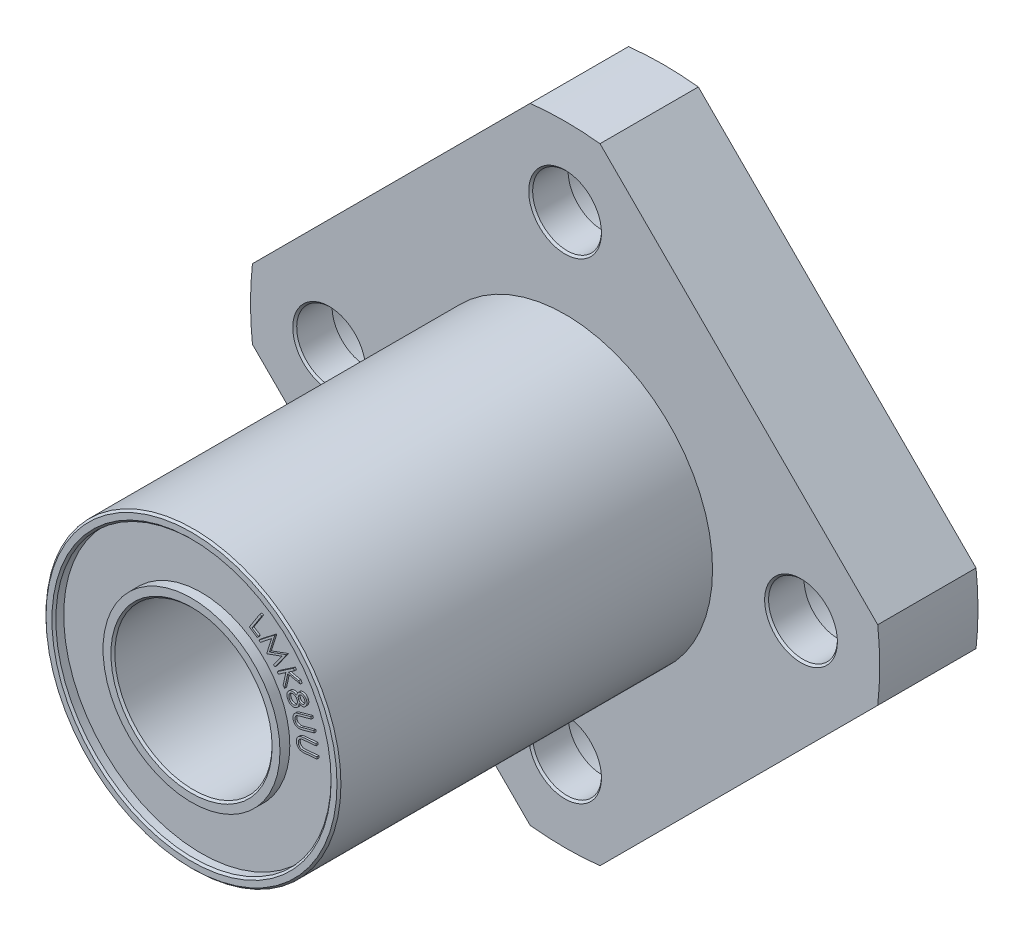
from build123d import *

# Parameters (mm, degrees)
BOSS_EXTRUDE1_DEPTH = 5
SKETCH2_R           = 7.5
BOSS_EXTRUDE2_DEPTH = 19
SKETCH3_R           = 3
CUT_EXTRUDE1_DEPTH  = 3.1
SKETCH4_R           = 1.75
CUT_EXTRUDE2_DEPTH  = 1.9
CHAMFER1_SIZE       = 0.1
SKETCH5_R           = 4
CUT_EXTRUDE3_DEPTH  = 33.984845005
SKETCH6_R           = 7
SKETCH6_R_2         = 4.5
CUT_EXTRUDE4_DEPTH  = 0.5
CUT_EXTRUDE5_START  = -0.5
SKETCH7_R           = 7
SKETCH7_R_2         = 4.5
CUT_EXTRUDE5_DEPTH  = 0.5
BOSS_EXTRUDE3_DEPTH = 0.1
CHAMFER2_SIZE       = 0.1
BOSS_EXTRUDE4_DEPTH = 0.1


# Read off the part's stored shape, not the designer's step: CirPattern1
with BuildPart() as part:
    # Sketch1 → Boss-Extrude1 (new body)
    with BuildSketch(Plane.XY):
        with BuildLine():
            Line((-1.776611319, 15.901058211), (-15.901058211, 1.776611319))
            ThreePointArc((-15.901058211, 1.776611319), (-16, 0), (-15.901058211, -1.776611319))
            Line((-15.901058211, -1.776611319), (-1.776611319, -15.901058211))
            ThreePointArc((-1.776611319, -15.901058211), (0, -16), (1.776611319, -15.901058211))
            Line((1.776611319, -15.901058211), (15.901058211, -1.776611319))
            ThreePointArc((15.901058211, -1.776611319), (16, 0), (15.901058211, 1.776611319))
            Line((15.901058211, 1.776611319), (1.776611319, 15.901058211))
            ThreePointArc((1.776611319, 15.901058211), (0, 16), (-1.776611319, 15.901058211))
        make_face()
    extrude(amount=BOSS_EXTRUDE1_DEPTH)

    # Sketch2 → Boss-Extrude2 (add)
    with BuildSketch(Plane.XY.offset(5)):
        Circle(SKETCH2_R)
    extrude(amount=BOSS_EXTRUDE2_DEPTH)

    # Sketch3 → Cut-Extrude1 (cut)
    with BuildSketch(Plane(origin=(0, 0, 0), x_dir=(-1, 0, 0), z_dir=(0, 0, -1))):
        with Locations((0, 12)):
            Circle(SKETCH3_R)
    extrude(amount=-CUT_EXTRUDE1_DEPTH, mode=Mode.SUBTRACT)

    # Sketch4 → Cut-Extrude2 (cut)
    with BuildSketch(Plane(origin=(0, 0, 3.1), x_dir=(-1, 0, 0), z_dir=(0, 0, -1))):
        with Locations((0, 12)):
            Circle(SKETCH4_R)
    extrude(amount=-CUT_EXTRUDE2_DEPTH, mode=Mode.SUBTRACT)

    # Chamfer1
    chamfer1_edges = [part.edges().sort_by_distance(p)[0] for p in [
        (-7.5, 0, 24),
        (3, 12, 0),
        (1.75, 12, 5),
    ]]
    chamfer(chamfer1_edges, length=CHAMFER1_SIZE)

    # CirPattern1 outline → CirPattern1 (revolve, cut)
    with BuildSketch(Plane(origin=(-12, 0, 0), x_dir=(1, 0, 0), z_dir=(0, -1, 0))):
        Polygon((0, 0), (3.1, 0), (3, 0.1), (3, 3.1), (1.75, 3.1), (1.75, 4.9), (1.85, 5), (0, 5), align=None)
    revolve(axis=Axis((-12, 0, 0), (0, 0, 1)), mode=Mode.SUBTRACT)

    # CirPattern1 2 outline → CirPattern1 2 (revolve, cut)
    with BuildSketch(Plane.XZ.offset(12)):
        Polygon((0, 0), (3.1, 0), (3, 0.1), (3, 3.1), (1.75, 3.1), (1.75, 4.9), (1.85, 5), (0, 5), align=None)
    revolve(axis=Axis((0, -12, 0), (0, 0, 1)), mode=Mode.SUBTRACT)

    # CirPattern1 3 outline → CirPattern1 3 (revolve, cut)
    with BuildSketch(Plane(origin=(12, 0, 0), x_dir=(1, 0, 0), z_dir=(0, -1, 0))):
        Polygon((0, 0), (3.1, 0), (3, 0.1), (3, 3.1), (1.75, 3.1), (1.75, 4.9), (1.85, 5), (0, 5), align=None)
    revolve(axis=Axis((12, 0, 0), (0, 0, 1)), mode=Mode.SUBTRACT)

    # Sketch5 → Cut-Extrude3 (cut, through all)
    with BuildSketch(Plane.XY.offset(24)):
        Circle(SKETCH5_R)
    extrude(amount=-CUT_EXTRUDE3_DEPTH, mode=Mode.SUBTRACT)

    # Sketch6 → Cut-Extrude4 (cut)
    with BuildSketch(Plane.XY.offset(24)):
        Circle(SKETCH6_R)
        Circle(SKETCH6_R_2, mode=Mode.SUBTRACT)
    extrude(amount=-CUT_EXTRUDE4_DEPTH, mode=Mode.SUBTRACT)

    # Sketch7 → Cut-Extrude5 (cut)
    with BuildSketch(Plane(origin=(0, 0, 0), x_dir=(-1, 0, 0), z_dir=(0, 0, -1)).offset(CUT_EXTRUDE5_START)):
        with Locations(Location((0, 0, 0), (0, 0, 180))):
            Circle(SKETCH7_R)
        with Locations(Location((0, 0, 0), (0, 0, 180))):
            Circle(SKETCH7_R_2, mode=Mode.SUBTRACT)
    extrude(amount=CUT_EXTRUDE5_DEPTH, mode=Mode.SUBTRACT)

    # Sketch8 → Boss-Extrude3 (add)
    # profile 1 of 6: a face of its own
    with BuildSketch(Plane.XY.offset(23.5)):
        with BuildLine():
            Line((5.925489592, 0.855844326), (5.934504015, 0.756485352))
            Line((5.934504015, 0.756485352), (5.334143438, 0.702999775))
            add(Edge.make_bspline(
                [(5.334143438, 0.702999775), (5.32566379, 0.702193023), (5.309504878, 0.700655668), (5.286517337, 0.69855424), (5.266100387, 0.696265421), (5.248184857, 0.69435885), (5.232842747, 0.692290465), (5.219994042, 0.690596333), (5.209718452, 0.688776827), (5.203732351, 0.68752027), (5.201130618, 0.686974134)],
                knots=[0, 0, 0, 0, 1.525178909, 2.906397894, 4.132983972, 5.203766403, 6.132111869, 6.904826644, 7.524005854, 8, 8, 8, 8], degree=3))
            add(Edge.make_bspline(
                [(5.201130618, 0.686974134), (5.191867071, 0.684607083), (5.173877337, 0.680010289), (5.148469106, 0.670504123), (5.125812189, 0.658293312), (5.105376642, 0.644029261), (5.087406658, 0.626591068), (5.071641766, 0.605856508), (5.058124014, 0.581544919), (5.046575188, 0.554545057), (5.037387422, 0.525932937), (5.031586366, 0.496839788), (5.028983183, 0.467922575), (5.02996775, 0.448860664), (5.030457541, 0.43937798)],
                knots=[0, 0, 0, 0, 1.040318006, 2.020289116, 2.943757236, 3.835120411, 4.724347588, 5.657602581, 6.66006304, 7.744192986, 8.849816824, 9.924550865, 10.967531254, 12, 12, 12, 12], degree=3))
            add(Edge.make_bspline(
                [(5.030457541, 0.43937798), (5.03136736, 0.431188981), (5.033171182, 0.414953355), (5.03986852, 0.391333276), (5.047971968, 0.368174789), (5.059361592, 0.346269231), (5.072630083, 0.325611166), (5.088178803, 0.306998627), (5.105299996, 0.290121841), (5.124417644, 0.275483675), (5.145390355, 0.262968277), (5.168234603, 0.252827401), (5.192657987, 0.244416364), (5.209826878, 0.240996855), (5.218558502, 0.239257788)],
                knots=[0, 0, 0, 0, 0.999247279, 1.981121953, 2.974291914, 3.975611538, 4.972386123, 5.951845026, 6.915590391, 7.887495168, 8.869704895, 9.875418162, 10.919496212, 12, 12, 12, 12], degree=3))
            add(Edge.make_bspline(
                [(5.218558502, 0.239257788), (5.222158886, 0.23873499), (5.230197235, 0.237567771), (5.243593661, 0.237008393), (5.259489401, 0.236442127), (5.277854147, 0.237148768), (5.298704911, 0.237490897), (5.321929118, 0.239132792), (5.347649654, 0.240823216), (5.365596582, 0.242424439), (5.375008823, 0.243264198)],
                knots=[0, 0, 0, 0, 0.55655491, 1.242584847, 2.050306808, 2.990865919, 4.054297669, 5.242096693, 6.553621584, 8, 8, 8, 8], degree=3))
            Line((5.375008823, 0.243264198), (5.9753694, 0.296749775))
            Line((5.9753694, 0.296749775), (5.984383823, 0.197390801))
            Line((5.984383823, 0.197390801), (5.384023246, 0.143905224))
            add(Edge.make_bspline(
                [(5.384023246, 0.143905224), (5.373211881, 0.142949919), (5.352078945, 0.141082589), (5.320998727, 0.13981124), (5.291480147, 0.139200146), (5.263476684, 0.139225831), (5.23702622, 0.14076404), (5.212014977, 0.142832812), (5.188547833, 0.1460488), (5.166427975, 0.150188078), (5.145329296, 0.155871401), (5.124899422, 0.163085632), (5.104941632, 0.171879312), (5.085693586, 0.18265819), (5.066768101, 0.19481227), (5.048560513, 0.208989038), (5.030727706, 0.224597109), (5.013494589, 0.241715205), (4.997618338, 0.260408173), (4.983210688, 0.280358363), (4.970811923, 0.301659506), (4.96021297, 0.324130608), (4.951288447, 0.347757984), (4.944388351, 0.372578048), (4.939035891, 0.398610587), (4.937096168, 0.416453135), (4.936106579, 0.425555865)],
                knots=[0, 0, 0, 0, 1.297295073, 2.535817944, 3.717446076, 4.827019234, 5.882167868, 6.883815634, 7.826441086, 8.71251613, 9.572239827, 10.435661277, 11.300446889, 12.175778163, 13.070262726, 13.986702823, 14.931353977, 15.902184343, 16.887477315, 17.8599471, 18.840182931, 19.829251789, 20.827043556, 21.855526343, 22.905954202, 24, 24, 24, 24], degree=3))
            add(Edge.make_bspline(
                [(4.936106579, 0.425555865), (4.935367592, 0.435431874), (4.933915882, 0.454832882), (4.934131648, 0.483565269), (4.936469178, 0.511375946), (4.940068415, 0.538335369), (4.945961429, 0.564388185), (4.953774024, 0.589426726), (4.963463315, 0.613583775), (4.974807685, 0.636815408), (4.987958325, 0.658676609), (5.002474319, 0.678993421), (5.018052301, 0.697842102), (5.03542117, 0.714607921), (5.053891189, 0.729902416), (5.073585583, 0.743629215), (5.094736586, 0.755538595), (5.10965615, 0.762022543), (5.117196323, 0.765299454)],
                knots=[0, 0, 0, 0, 1.14955604, 2.258254819, 3.331555301, 4.388518531, 5.41360965, 6.428801967, 7.430823728, 8.432875483, 9.427431048, 10.389078009, 11.330127593, 12.262159734, 13.187330513, 14.112111391, 15.045883181, 16, 16, 16, 16], degree=3))
            add(Edge.make_bspline(
                [(5.117196323, 0.765299454), (5.122381627, 0.767238486), (5.133626115, 0.771443333), (5.152284255, 0.776646223), (5.173831728, 0.781944868), (5.198386419, 0.786626132), (5.225925527, 0.790972353), (5.256303554, 0.795200638), (5.289710992, 0.798956822), (5.312972852, 0.801191141), (5.325129015, 0.802358749)],
                knots=[0, 0, 0, 0, 0.627046518, 1.359769361, 2.192923758, 3.141131698, 4.19099758, 5.352002244, 6.616211572, 8, 8, 8, 8], degree=3))
            Line((5.325129015, 0.802358749), (5.925489592, 0.855844326))
        make_face()
    # profile 2 of 6: a face of its own
    with BuildSketch(Plane.XY.offset(23.5)):
        with BuildLine():
            Line((5.668347512, 1.912832294), (5.69478982, 1.817079089))
            Line((5.69478982, 1.817079089), (5.11666482, 1.656622358))
            add(Edge.make_bspline(
                [(5.11666482, 1.656622358), (5.108518512, 1.65435197), (5.093021196, 1.650032846), (5.070949217, 1.64388298), (5.051400067, 1.638081508), (5.034261614, 1.632800396), (5.019596193, 1.628321885), (5.00737222, 1.624253635), (4.997659852, 1.620771234), (4.992057372, 1.618381462), (4.989661615, 1.617359537)],
                knots=[0, 0, 0, 0, 1.525982139, 2.90298703, 4.134393669, 5.205390779, 6.139083073, 6.901122188, 7.530093042, 8, 8, 8, 8], degree=3))
            add(Edge.make_bspline(
                [(4.989661615, 1.617359537), (4.980946599, 1.613484526), (4.964061321, 1.605976721), (4.941058308, 1.5917477), (4.920891317, 1.576015314), (4.903640502, 1.558197514), (4.889056162, 1.537994166), (4.87756019, 1.51463398), (4.86830054, 1.488419599), (4.862020188, 1.459817458), (4.858046655, 1.43017998), (4.857822239, 1.400701162), (4.860098349, 1.371863612), (4.864611621, 1.353360926), (4.86686514, 1.344122358)],
                knots=[0, 0, 0, 0, 1.040886317, 2.016709358, 2.94631653, 3.828463649, 4.717131147, 5.656644996, 6.662540037, 7.747282736, 8.850194311, 9.922579012, 10.962723838, 12, 12, 12, 12], degree=3))
            add(Edge.make_bspline(
                [(4.86686514, 1.344122358), (4.869277979, 1.336303979), (4.874063448, 1.320797509), (4.884620212, 1.298840881), (4.896981341, 1.277859889), (4.911793827, 1.258332276), (4.928501456, 1.24050005), (4.947097142, 1.225044535), (4.966978778, 1.21169617), (4.988373648, 1.20083122), (5.011162087, 1.192370902), (5.035289377, 1.186441228), (5.060721719, 1.18265684), (5.078122628, 1.182396474), (5.087017384, 1.182263383)],
                knots=[0, 0, 0, 0, 0.99799512, 1.979359463, 2.966736421, 3.968157373, 4.966152493, 5.944496672, 6.914786813, 7.884905595, 8.867996412, 9.876695709, 10.914638723, 12, 12, 12, 12], degree=3))
            add(Edge.make_bspline(
                [(5.087017384, 1.182263383), (5.090691868, 1.182430793), (5.098793881, 1.182799922), (5.11205872, 1.184195029), (5.127568833, 1.187033646), (5.145503645, 1.190313185), (5.165729395, 1.194791581), (5.188225296, 1.20024068), (5.213067114, 1.206655726), (5.230386796, 1.211418572), (5.239461294, 1.213914024)],
                knots=[0, 0, 0, 0, 0.565872888, 1.247715368, 2.049956286, 2.990905526, 4.05284157, 5.236416196, 6.552043938, 8, 8, 8, 8], degree=3))
            Line((5.239461294, 1.213914024), (5.817586294, 1.374370755))
            Line((5.817586294, 1.374370755), (5.844228923, 1.27861755))
            Line((5.844228923, 1.27861755), (5.266103923, 1.118160819))
            add(Edge.make_bspline(
                [(5.266103923, 1.118160819), (5.255636653, 1.115358075), (5.235233395, 1.109894842), (5.20513533, 1.102991553), (5.176476238, 1.096787255), (5.148987721, 1.092236522), (5.1227989, 1.08879565), (5.097938361, 1.086558834), (5.07440785, 1.085524797), (5.052001711, 1.085668104), (5.030286406, 1.087189215), (5.008979994, 1.090640145), (4.987870756, 1.095855557), (4.967019038, 1.102949705), (4.946390339, 1.111550657), (4.925919933, 1.121843538), (4.905820885, 1.134145009), (4.885869197, 1.147783864), (4.866821505, 1.163096136), (4.849411527, 1.180273771), (4.833239274, 1.19870435), (4.818854455, 1.218820456), (4.805971702, 1.240320271), (4.794769044, 1.263346578), (4.784813671, 1.287795335), (4.779716299, 1.304944227), (4.777121551, 1.31367364)],
                knots=[0, 0, 0, 0, 1.301871374, 2.537664454, 3.709944619, 4.824492676, 5.884332816, 6.88310506, 7.822665497, 8.713266644, 9.57413531, 10.435452501, 11.303321425, 12.183709044, 13.079211563, 13.986993547, 14.933652318, 15.90841869, 16.8895369, 17.865392268, 18.843553613, 19.832188077, 20.83250591, 21.851535406, 22.90635294, 24, 24, 24, 24], degree=3))
            add(Edge.make_bspline(
                [(4.777121551, 1.31367364), (4.774653107, 1.323192645), (4.769783652, 1.341970618), (4.764853472, 1.370234772), (4.761779068, 1.397935838), (4.76078258, 1.42504939), (4.761672487, 1.451588571), (4.76501299, 1.477479981), (4.769963866, 1.502884964), (4.776982109, 1.527586844), (4.785693528, 1.55142536), (4.796366446, 1.573802297), (4.808432956, 1.594922812), (4.822304056, 1.614469227), (4.837550346, 1.632849828), (4.854480218, 1.649703862), (4.872926079, 1.665273006), (4.88634141, 1.674303573), (4.893107128, 1.678857935)],
                knots=[0, 0, 0, 0, 1.146913052, 2.262494894, 3.343905311, 4.396333313, 5.425406427, 6.43807134, 7.438799435, 8.442555275, 9.430956859, 10.396246366, 11.331616173, 12.265329969, 13.188979646, 14.114434515, 15.049057857, 16, 16, 16, 16], degree=3))
            add(Edge.make_bspline(
                [(4.893107128, 1.678857935), (4.89780492, 1.681740557), (4.908029325, 1.688014376), (4.925461214, 1.696319908), (4.945687671, 1.70523482), (4.968783605, 1.714394867), (4.995042843, 1.723539825), (5.024058345, 1.733140833), (5.056163465, 1.742739305), (5.078528635, 1.749067038), (5.090222512, 1.752375563)],
                knots=[0, 0, 0, 0, 0.62657121, 1.363687, 2.193510589, 3.141336482, 4.188744648, 5.356081827, 6.617598124, 8, 8, 8, 8], degree=3))
            Line((5.090222512, 1.752375563), (5.668347512, 1.912832294))
        make_face()
    # profile 3 of 6: a face of its own
    with BuildSketch(Plane.XY.offset(23.5)):
        with BuildLine():
            add(Edge.make_bspline(
                [(5.068846447, 2.207250242), (5.068449641, 2.198098697), (5.067678076, 2.180304075), (5.065371928, 2.154265959), (5.061486794, 2.129754817), (5.056791706, 2.10656962), (5.050686004, 2.084937649), (5.043882666, 2.06458082), (5.035253018, 2.045896355), (5.022974723, 2.022788351), (5.004054813, 1.996794252), (4.977481897, 1.969253013), (4.946369627, 1.94575856), (4.923082177, 1.93387139), (4.911194204, 1.927803127)],
                knots=[0, 0, 0, 0, 0.968459383, 1.883110252, 2.761769305, 3.591142427, 4.382474271, 5.13711769, 5.857532468, 6.555635775, 7.901567376, 9.239588109, 10.590841664, 12, 12, 12, 12], degree=3))
            add(Edge.make_bspline(
                [(4.911194204, 1.927803127), (4.902510528, 1.924030507), (4.885414495, 1.91660314), (4.858874708, 1.908438299), (4.832223764, 1.902520242), (4.805243924, 1.899368063), (4.778097719, 1.898560137), (4.750738767, 1.900149918), (4.723177872, 1.904350498), (4.705030028, 1.909016482), (4.695849652, 1.911376845)],
                knots=[0, 0, 0, 0, 1.028793301, 2.025442262, 3.013805146, 3.993650503, 4.974275682, 5.963438321, 6.969772911, 8, 8, 8, 8], degree=3))
            add(Edge.make_bspline(
                [(4.695849652, 1.911376845), (4.68471529, 1.91488507), (4.662627434, 1.921844532), (4.631583602, 1.937548061), (4.602353412, 1.956309568), (4.575364725, 1.979106919), (4.550191834, 2.005189417), (4.527372304, 2.035149443), (4.506308585, 2.068547656), (4.494560976, 2.092807607), (4.488517921, 2.105287101)],
                knots=[0, 0, 0, 0, 0.953723249, 1.891954189, 2.836036394, 3.790166408, 4.775461434, 5.796096186, 6.866295962, 8, 8, 8, 8], degree=3))
            add(Edge.make_bspline(
                [(4.488517921, 2.105287101), (4.483154442, 2.117486766), (4.472731326, 2.141194977), (4.46117975, 2.177257211), (4.452955486, 2.21220306), (4.448659475, 2.246184489), (4.448242898, 2.279177583), (4.451416329, 2.311107481), (4.458209258, 2.342090701), (4.468941226, 2.371608705), (4.482447652, 2.399414419), (4.497379241, 2.425552759), (4.514066574, 2.44948916), (4.532341979, 2.471311798), (4.552463192, 2.490787498), (4.574200133, 2.508084994), (4.597586359, 2.523327742), (4.614295549, 2.531599269), (4.622732665, 2.535775884)],
                knots=[0, 0, 0, 0, 1.265814099, 2.459919181, 3.592951131, 4.673698586, 5.708198696, 6.722332329, 7.716978537, 8.714616535, 9.699578893, 10.652029904, 11.572768392, 12.469014469, 13.353135716, 14.229272058, 15.105890925, 16, 16, 16, 16], degree=3))
            add(Edge.make_bspline(
                [(4.622732665, 2.535775884), (4.635217702, 2.540986777), (4.659835307, 2.551261455), (4.69879631, 2.559549091), (4.738084876, 2.562009145), (4.771001435, 2.559055704), (4.797517142, 2.553899387), (4.817821929, 2.54770802), (4.838549789, 2.539918409), (4.85956245, 2.529989351), (4.881012379, 2.518326248), (4.902887122, 2.504929106), (4.924925951, 2.489408133), (4.939421151, 2.478080645), (4.946851255, 2.472274281)],
                knots=[0, 0, 0, 0, 1.388140885, 2.737092768, 4.071155722, 5.421451417, 6.121393357, 6.844540041, 7.600459887, 8.395737338, 9.231084225, 10.10923621, 11.030812232, 12, 12, 12, 12], degree=3))
            add(Edge.make_bspline(
                [(4.946851255, 2.472274281), (4.947859572, 2.485472853), (4.949811814, 2.511027115), (4.958017107, 2.547537318), (4.969703915, 2.580993231), (4.98567255, 2.610998303), (5.004923056, 2.637546729), (5.027173173, 2.660512256), (5.052417343, 2.679629726), (5.071093131, 2.68921766), (5.080465037, 2.694029089)],
                knots=[0, 0, 0, 0, 1.162968004, 2.251666895, 3.280835445, 4.271336515, 5.2299466, 6.156145039, 7.074714467, 8, 8, 8, 8], degree=3))
            add(Edge.make_bspline(
                [(5.080465037, 2.694029089), (5.090435673, 2.698186761), (5.110498492, 2.706552791), (5.143030581, 2.712771317), (5.176953631, 2.715071109), (5.212030096, 2.712508703), (5.247368385, 2.705757481), (5.281649805, 2.693447962), (5.314598281, 2.676764716), (5.345448052, 2.655228251), (5.37405872, 2.630066976), (5.399608029, 2.601584928), (5.421573393, 2.569763646), (5.433163176, 2.546678097), (5.439038755, 2.534974601)],
                knots=[0, 0, 0, 0, 0.892905114, 1.796695251, 2.728102637, 3.704038418, 4.70220638, 5.699546127, 6.711478373, 7.753451522, 8.807848756, 9.861781461, 10.91600452, 12, 12, 12, 12], degree=3))
            add(Edge.make_bspline(
                [(5.439038755, 2.534974601), (5.443930275, 2.523258631), (5.453636816, 2.500009916), (5.463091389, 2.463583453), (5.467385715, 2.426531081), (5.467489056, 2.389463209), (5.462869655, 2.353055806), (5.453953694, 2.31807758), (5.440047332, 2.285176859), (5.422370547, 2.254417969), (5.400965816, 2.226692225), (5.376804971, 2.202359393), (5.349834169, 2.182000408), (5.329962692, 2.171849842), (5.32004837, 2.166785499)],
                knots=[0, 0, 0, 0, 1.063889513, 2.1111408, 3.143355492, 4.184991612, 5.212333461, 6.213406355, 7.2024869, 8.19858184, 9.180933164, 10.131317633, 11.067672782, 12, 12, 12, 12], degree=3))
            add(Edge.make_bspline(
                [(5.32004837, 2.166785499), (5.309946334, 2.162501276), (5.290068551, 2.154071206), (5.258650823, 2.147511495), (5.227225531, 2.145100643), (5.195610847, 2.147846089), (5.163804139, 2.15534097), (5.132046289, 2.168124321), (5.099861899, 2.185227826), (5.079441657, 2.19972715), (5.068846447, 2.207250242)],
                knots=[0, 0, 0, 0, 0.978740193, 1.925867828, 2.853326615, 3.78765464, 4.750394553, 5.763439177, 6.839542042, 8, 8, 8, 8], degree=3))
        make_face()
        with BuildLine():
            add(Edge.make_bspline(
                [(5.349295165, 2.498916909), (5.346388709, 2.504912022), (5.340683277, 2.516680549), (5.33059023, 2.533148632), (5.319555443, 2.548240647), (5.307566382, 2.561941007), (5.294339574, 2.574072833), (5.280225694, 2.584861345), (5.265035965, 2.594149886), (5.249124579, 2.601898943), (5.232742185, 2.608066289), (5.216404171, 2.612713962), (5.200163342, 2.615597982), (5.184103364, 2.616603454), (5.168173472, 2.615809178), (5.152451204, 2.61317419), (5.136942495, 2.608756843), (5.126968492, 2.604587986), (5.121931383, 2.602482614)],
                knots=[0, 0, 0, 0, 1.149395412, 2.256286471, 3.328184039, 4.373353672, 5.392854082, 6.420917513, 7.43493108, 8.460666231, 9.471005348, 10.452536461, 11.388557381, 12.31236555, 13.224015913, 14.135374828, 15.058319893, 16, 16, 16, 16], degree=3))
            add(Edge.make_bspline(
                [(5.121931383, 2.602482614), (5.117057866, 2.600060865), (5.107319296, 2.595221573), (5.09392357, 2.585905062), (5.081622161, 2.575175309), (5.070281808, 2.563122449), (5.060292129, 2.549413558), (5.05147591, 2.534262466), (5.043640337, 2.517712862), (5.036891808, 2.49999038), (5.031836477, 2.481521669), (5.02800751, 2.463007167), (5.026560608, 2.444526118), (5.026458698, 2.426226386), (5.028270155, 2.408095623), (5.031987254, 2.390232237), (5.037080461, 2.372362423), (5.042069064, 2.36091311), (5.044607665, 2.355086781)],
                knots=[0, 0, 0, 0, 0.913668956, 1.82575126, 2.732640418, 3.653723188, 4.600962196, 5.576821569, 6.595865599, 7.67558099, 8.759313344, 9.811378515, 10.847763744, 11.869030068, 12.88411134, 13.90315537, 14.932957213, 16, 16, 16, 16], degree=3))
            add(Edge.make_bspline(
                [(5.044607665, 2.355086781), (5.048284603, 2.347824876), (5.055575386, 2.333425674), (5.069991965, 2.313880382), (5.086394644, 2.29586277), (5.105381339, 2.280153398), (5.126087959, 2.267058806), (5.147936384, 2.256555855), (5.170928312, 2.249629447), (5.194490284, 2.245614511), (5.217974423, 2.244671696), (5.240621591, 2.246304199), (5.262067665, 2.251164199), (5.27536993, 2.256485862), (5.281987473, 2.259133255)],
                knots=[0, 0, 0, 0, 1.033440913, 2.049148698, 3.076712573, 4.125836443, 5.171725349, 6.185870288, 7.198449967, 8.214689992, 9.217539294, 10.180072461, 11.094631724, 12, 12, 12, 12], degree=3))
            add(Edge.make_bspline(
                [(5.281987473, 2.259133255), (5.286450072, 2.261372987), (5.295303123, 2.26581624), (5.307586548, 2.274196595), (5.31905052, 2.283649925), (5.329771987, 2.294281901), (5.339361459, 2.306368733), (5.347973593, 2.31970504), (5.355815144, 2.334139502), (5.362612513, 2.349718518), (5.368091689, 2.366233517), (5.371480963, 2.383594102), (5.372881188, 2.40147392), (5.372202268, 2.41993535), (5.369668057, 2.438965412), (5.364577219, 2.458508854), (5.358142672, 2.478756237), (5.35229232, 2.492087341), (5.349295165, 2.498916909)],
                knots=[0, 0, 0, 0, 0.860813496, 1.707710012, 2.558984899, 3.422647121, 4.308020033, 5.215681605, 6.159204509, 7.139647484, 8.145359271, 9.155483974, 10.184168523, 11.233300976, 12.338156028, 13.489558323, 14.713892653, 16, 16, 16, 16], degree=3))
        make_face(mode=Mode.SUBTRACT)
        with BuildLine():
            add(Edge.make_bspline(
                [(4.963678178, 2.316424922), (4.960022261, 2.323985849), (4.952823165, 2.338874548), (4.939618564, 2.359437671), (4.92541156, 2.378489779), (4.909571463, 2.395642993), (4.891938594, 2.410567644), (4.873329666, 2.424269905), (4.8528696, 2.435548924), (4.83150067, 2.445385575), (4.809437429, 2.452838937), (4.78747367, 2.458374154), (4.765733684, 2.461586917), (4.744250441, 2.462686143), (4.72302353, 2.461217665), (4.702099297, 2.457553458), (4.681322943, 2.451882277), (4.668078206, 2.446130381), (4.661394524, 2.443227807)],
                knots=[0, 0, 0, 0, 1.105967104, 2.177829486, 3.214540437, 4.235783682, 5.246660255, 6.255389288, 7.276025643, 8.319735441, 9.352254316, 10.340505709, 11.30133895, 12.244025509, 13.170134609, 14.09899937, 15.040699511, 16, 16, 16, 16], degree=3))
            add(Edge.make_bspline(
                [(4.661394524, 2.443227807), (4.65340095, 2.439084801), (4.637467719, 2.430826734), (4.615529994, 2.414853357), (4.596348937, 2.395333353), (4.579260703, 2.373394663), (4.565295653, 2.349085833), (4.554897482, 2.322920525), (4.548566057, 2.295157614), (4.545700569, 2.266135215), (4.547032609, 2.236097433), (4.552173343, 2.205470315), (4.560940392, 2.17414979), (4.569734248, 2.153806384), (4.574255101, 2.143347999)],
                knots=[0, 0, 0, 0, 0.927068282, 1.8478836, 2.782151879, 3.738784362, 4.70671096, 5.661286887, 6.629433621, 7.631896489, 8.658076311, 9.718123236, 10.826905017, 12, 12, 12, 12], degree=3))
            add(Edge.make_bspline(
                [(4.574255101, 2.143347999), (4.578136038, 2.135402296), (4.585727636, 2.119859508), (4.598973045, 2.098184192), (4.613483337, 2.078636269), (4.629083759, 2.061024592), (4.646184113, 2.04583049), (4.664394857, 2.032593532), (4.68391658, 2.021588787), (4.704459319, 2.012600259), (4.725503823, 2.005898144), (4.746561418, 2.001209525), (4.767354885, 1.998618734), (4.787954544, 1.997933884), (4.808315933, 1.999542257), (4.828418893, 2.003451646), (4.848381052, 2.009197653), (4.861229264, 2.014610129), (4.867724652, 2.017346396)],
                knots=[0, 0, 0, 0, 1.188600653, 2.325051347, 3.409706374, 4.458846233, 5.48262878, 6.479439743, 7.48064881, 8.489877943, 9.489394619, 10.445755035, 11.386819497, 12.303055338, 13.212756645, 14.126701893, 15.052957755, 16, 16, 16, 16], degree=3))
            add(Edge.make_bspline(
                [(4.867724652, 2.017346396), (4.873882547, 2.020409629), (4.88603323, 2.026453964), (4.902755144, 2.037954232), (4.918328928, 2.050745854), (4.932347137, 2.065428025), (4.944899265, 2.081825224), (4.955829847, 2.099990006), (4.96574055, 2.119603), (4.973810985, 2.140704237), (4.980185427, 2.162610418), (4.98469611, 2.184773536), (4.986687281, 2.206943215), (4.986397777, 2.228999009), (4.98436424, 2.251051068), (4.979501656, 2.272975737), (4.973071428, 2.295017969), (4.966845411, 2.309206887), (4.963678178, 2.316424922)],
                knots=[0, 0, 0, 0, 0.948284653, 1.871143928, 2.794003203, 3.72620488, 4.666392077, 5.638564507, 6.648455207, 7.696003662, 8.751912443, 9.794909498, 10.812969104, 11.81767295, 12.836608378, 13.863392588, 14.913087951, 16, 16, 16, 16], degree=3))
        make_face(mode=Mode.SUBTRACT)
    # profile 4 of 6: a face of its own
    with BuildSketch(Plane.XY.offset(23.5)):
        Polygon((4.77849321, 3.59687492), (4.835384236, 3.513341267), (4.527892249, 3.304406972), (5.057539685, 3.186217869), (5.132860198, 3.075440626), (4.497643851, 3.219471074), (4.334182313, 2.487900561), (4.260464364, 2.596474279), (4.398084557, 3.216065626), (4.015873018, 2.956450241), (3.958981992, 3.039983895), align=None)
    # profile 5 of 6: a face of its own
    with BuildSketch(Plane.XY.offset(23.5)):
        Polygon((3.032610272, 3.963979142), (3.823275336, 4.58457209), (3.835094247, 4.573354142), (3.562057388, 3.703963116), (4.416224054, 4.016262795), (4.427842644, 4.005044847), (3.842105465, 3.187937475), (3.771392324, 3.255846129), (4.193467644, 3.836775616), (3.447073413, 3.566743565), (3.429044567, 3.583971129), (3.668026939, 4.348193885), (3.10192117, 3.897673052), align=None)
    # profile 6 of 6: a face of its own
    with BuildSketch(Plane.XY.offset(23.5)):
        Polygon((3.082645541, 5.137027402), (3.166980477, 5.082339902), (2.677196823, 4.325328684), (2.999111887, 4.117195671), (2.946828233, 4.036266184), (2.540578233, 4.299086697), align=None)
    extrude(amount=BOSS_EXTRUDE3_DEPTH)

    # Chamfer2
    chamfer2_edges = [part.edges().sort_by_distance(p)[0] for p in [
        (-4, 0, 0),
        (-4, 0, 24),
        (-7, 0, 24),
    ]]
    chamfer(chamfer2_edges, length=CHAMFER2_SIZE)

    # Sketch9 → Boss-Extrude4 (add)
    # profile 1 of 6: a face of its own
    with BuildSketch(Plane(origin=(0, 0, 0.5), x_dir=(-1, 0, 0), z_dir=(0, 0, -1))):
        with BuildLine():
            Line((5.925489592, 0.855844326), (5.934504015, 0.756485352))
            Line((5.934504015, 0.756485352), (5.334143438, 0.702999775))
            add(Edge.make_bspline(
                [(5.334143438, 0.702999775), (5.32566379, 0.702193023), (5.309504878, 0.700655668), (5.286517337, 0.69855424), (5.266100387, 0.696265421), (5.248184857, 0.69435885), (5.232842747, 0.692290465), (5.219994042, 0.690596333), (5.209718452, 0.688776827), (5.203732351, 0.68752027), (5.201130618, 0.686974134)],
                knots=[0, 0, 0, 0, 1.525178909, 2.906397894, 4.132983972, 5.203766403, 6.132111869, 6.904826644, 7.524005854, 8, 8, 8, 8], degree=3))
            add(Edge.make_bspline(
                [(5.201130618, 0.686974134), (5.191867071, 0.684607083), (5.173877337, 0.680010289), (5.148469106, 0.670504123), (5.125812189, 0.658293312), (5.105376642, 0.644029261), (5.087406658, 0.626591068), (5.071641766, 0.605856508), (5.058124014, 0.581544919), (5.046575188, 0.554545057), (5.037387422, 0.525932937), (5.031586366, 0.496839788), (5.028983183, 0.467922575), (5.02996775, 0.448860664), (5.030457541, 0.43937798)],
                knots=[0, 0, 0, 0, 1.040318006, 2.020289116, 2.943757236, 3.835120411, 4.724347588, 5.657602581, 6.66006304, 7.744192986, 8.849816824, 9.924550865, 10.967531254, 12, 12, 12, 12], degree=3))
            add(Edge.make_bspline(
                [(5.030457541, 0.43937798), (5.03136736, 0.431188981), (5.033171182, 0.414953355), (5.03986852, 0.391333276), (5.047971968, 0.368174789), (5.059361592, 0.346269231), (5.072630083, 0.325611166), (5.088178803, 0.306998627), (5.105299996, 0.290121841), (5.124417644, 0.275483675), (5.145390355, 0.262968277), (5.168234603, 0.252827401), (5.192657987, 0.244416364), (5.209826878, 0.240996855), (5.218558502, 0.239257788)],
                knots=[0, 0, 0, 0, 0.999247279, 1.981121953, 2.974291914, 3.975611538, 4.972386123, 5.951845026, 6.915590391, 7.887495168, 8.869704895, 9.875418162, 10.919496212, 12, 12, 12, 12], degree=3))
            add(Edge.make_bspline(
                [(5.218558502, 0.239257788), (5.222158886, 0.23873499), (5.230197235, 0.237567771), (5.243593661, 0.237008393), (5.259489401, 0.236442127), (5.277854147, 0.237148768), (5.298704911, 0.237490897), (5.321929118, 0.239132792), (5.347649654, 0.240823216), (5.365596582, 0.242424439), (5.375008823, 0.243264198)],
                knots=[0, 0, 0, 0, 0.55655491, 1.242584847, 2.050306808, 2.990865919, 4.054297669, 5.242096693, 6.553621584, 8, 8, 8, 8], degree=3))
            Line((5.375008823, 0.243264198), (5.9753694, 0.296749775))
            Line((5.9753694, 0.296749775), (5.984383823, 0.197390801))
            Line((5.984383823, 0.197390801), (5.384023246, 0.143905224))
            add(Edge.make_bspline(
                [(5.384023246, 0.143905224), (5.373211881, 0.142949919), (5.352078945, 0.141082589), (5.320998727, 0.13981124), (5.291480147, 0.139200146), (5.263476684, 0.139225831), (5.23702622, 0.14076404), (5.212014977, 0.142832812), (5.188547833, 0.1460488), (5.166427975, 0.150188078), (5.145329296, 0.155871401), (5.124899422, 0.163085632), (5.104941632, 0.171879312), (5.085693586, 0.18265819), (5.066768101, 0.19481227), (5.048560513, 0.208989038), (5.030727706, 0.224597109), (5.013494589, 0.241715205), (4.997618338, 0.260408173), (4.983210688, 0.280358363), (4.970811923, 0.301659506), (4.96021297, 0.324130608), (4.951288447, 0.347757984), (4.944388351, 0.372578048), (4.939035891, 0.398610587), (4.937096168, 0.416453135), (4.936106579, 0.425555865)],
                knots=[0, 0, 0, 0, 1.297295073, 2.535817944, 3.717446076, 4.827019234, 5.882167868, 6.883815634, 7.826441086, 8.71251613, 9.572239827, 10.435661277, 11.300446889, 12.175778163, 13.070262726, 13.986702823, 14.931353977, 15.902184343, 16.887477315, 17.8599471, 18.840182931, 19.829251789, 20.827043556, 21.855526343, 22.905954202, 24, 24, 24, 24], degree=3))
            add(Edge.make_bspline(
                [(4.936106579, 0.425555865), (4.935367592, 0.435431874), (4.933915882, 0.454832882), (4.934131648, 0.483565269), (4.936469178, 0.511375946), (4.940068415, 0.538335369), (4.945961429, 0.564388185), (4.953774024, 0.589426726), (4.963463315, 0.613583775), (4.974807685, 0.636815408), (4.987958325, 0.658676609), (5.002474319, 0.678993421), (5.018052301, 0.697842102), (5.03542117, 0.714607921), (5.053891189, 0.729902416), (5.073585583, 0.743629215), (5.094736586, 0.755538595), (5.10965615, 0.762022543), (5.117196323, 0.765299454)],
                knots=[0, 0, 0, 0, 1.14955604, 2.258254819, 3.331555301, 4.388518531, 5.41360965, 6.428801967, 7.430823728, 8.432875483, 9.427431048, 10.389078009, 11.330127593, 12.262159734, 13.187330513, 14.112111391, 15.045883181, 16, 16, 16, 16], degree=3))
            add(Edge.make_bspline(
                [(5.117196323, 0.765299454), (5.122381627, 0.767238486), (5.133626115, 0.771443333), (5.152284255, 0.776646223), (5.173831728, 0.781944868), (5.198386419, 0.786626132), (5.225925527, 0.790972353), (5.256303554, 0.795200638), (5.289710992, 0.798956822), (5.312972852, 0.801191141), (5.325129015, 0.802358749)],
                knots=[0, 0, 0, 0, 0.627046518, 1.359769361, 2.192923758, 3.141131698, 4.19099758, 5.352002244, 6.616211572, 8, 8, 8, 8], degree=3))
            Line((5.325129015, 0.802358749), (5.925489592, 0.855844326))
        make_face()
    # profile 2 of 6: a face of its own
    with BuildSketch(Plane(origin=(0, 0, 0.5), x_dir=(-1, 0, 0), z_dir=(0, 0, -1))):
        with BuildLine():
            Line((5.668347512, 1.912832294), (5.69478982, 1.817079089))
            Line((5.69478982, 1.817079089), (5.11666482, 1.656622358))
            add(Edge.make_bspline(
                [(5.11666482, 1.656622358), (5.108518512, 1.65435197), (5.093021196, 1.650032846), (5.070949217, 1.64388298), (5.051400067, 1.638081508), (5.034261614, 1.632800396), (5.019596193, 1.628321885), (5.00737222, 1.624253635), (4.997659852, 1.620771234), (4.992057372, 1.618381462), (4.989661615, 1.617359537)],
                knots=[0, 0, 0, 0, 1.525982139, 2.90298703, 4.134393669, 5.205390779, 6.139083073, 6.901122188, 7.530093042, 8, 8, 8, 8], degree=3))
            add(Edge.make_bspline(
                [(4.989661615, 1.617359537), (4.980946599, 1.613484526), (4.964061321, 1.605976721), (4.941058308, 1.5917477), (4.920891317, 1.576015314), (4.903640502, 1.558197514), (4.889056162, 1.537994166), (4.87756019, 1.51463398), (4.86830054, 1.488419599), (4.862020188, 1.459817458), (4.858046655, 1.43017998), (4.857822239, 1.400701162), (4.860098349, 1.371863612), (4.864611621, 1.353360926), (4.86686514, 1.344122358)],
                knots=[0, 0, 0, 0, 1.040886317, 2.016709358, 2.94631653, 3.828463649, 4.717131147, 5.656644996, 6.662540037, 7.747282736, 8.850194311, 9.922579012, 10.962723838, 12, 12, 12, 12], degree=3))
            add(Edge.make_bspline(
                [(4.86686514, 1.344122358), (4.869277979, 1.336303979), (4.874063448, 1.320797509), (4.884620212, 1.298840881), (4.896981341, 1.277859889), (4.911793827, 1.258332276), (4.928501456, 1.24050005), (4.947097142, 1.225044535), (4.966978778, 1.21169617), (4.988373648, 1.20083122), (5.011162087, 1.192370902), (5.035289377, 1.186441228), (5.060721719, 1.18265684), (5.078122628, 1.182396474), (5.087017384, 1.182263383)],
                knots=[0, 0, 0, 0, 0.99799512, 1.979359463, 2.966736421, 3.968157373, 4.966152493, 5.944496672, 6.914786813, 7.884905595, 8.867996412, 9.876695709, 10.914638723, 12, 12, 12, 12], degree=3))
            add(Edge.make_bspline(
                [(5.087017384, 1.182263383), (5.090691868, 1.182430793), (5.098793881, 1.182799922), (5.11205872, 1.184195029), (5.127568833, 1.187033646), (5.145503645, 1.190313185), (5.165729395, 1.194791581), (5.188225296, 1.20024068), (5.213067114, 1.206655726), (5.230386796, 1.211418572), (5.239461294, 1.213914024)],
                knots=[0, 0, 0, 0, 0.565872888, 1.247715368, 2.049956286, 2.990905526, 4.05284157, 5.236416196, 6.552043938, 8, 8, 8, 8], degree=3))
            Line((5.239461294, 1.213914024), (5.817586294, 1.374370755))
            Line((5.817586294, 1.374370755), (5.844228923, 1.27861755))
            Line((5.844228923, 1.27861755), (5.266103923, 1.118160819))
            add(Edge.make_bspline(
                [(5.266103923, 1.118160819), (5.255636653, 1.115358075), (5.235233395, 1.109894842), (5.20513533, 1.102991553), (5.176476238, 1.096787255), (5.148987721, 1.092236522), (5.1227989, 1.08879565), (5.097938361, 1.086558834), (5.07440785, 1.085524797), (5.052001711, 1.085668104), (5.030286406, 1.087189215), (5.008979994, 1.090640145), (4.987870756, 1.095855557), (4.967019038, 1.102949705), (4.946390339, 1.111550657), (4.925919933, 1.121843538), (4.905820885, 1.134145009), (4.885869197, 1.147783864), (4.866821505, 1.163096136), (4.849411527, 1.180273771), (4.833239274, 1.19870435), (4.818854455, 1.218820456), (4.805971702, 1.240320271), (4.794769044, 1.263346578), (4.784813671, 1.287795335), (4.779716299, 1.304944227), (4.777121551, 1.31367364)],
                knots=[0, 0, 0, 0, 1.301871374, 2.537664454, 3.709944619, 4.824492676, 5.884332816, 6.88310506, 7.822665497, 8.713266644, 9.57413531, 10.435452501, 11.303321425, 12.183709044, 13.079211563, 13.986993547, 14.933652318, 15.90841869, 16.8895369, 17.865392268, 18.843553613, 19.832188077, 20.83250591, 21.851535406, 22.90635294, 24, 24, 24, 24], degree=3))
            add(Edge.make_bspline(
                [(4.777121551, 1.31367364), (4.774653107, 1.323192645), (4.769783652, 1.341970618), (4.764853472, 1.370234772), (4.761779068, 1.397935838), (4.76078258, 1.42504939), (4.761672487, 1.451588571), (4.76501299, 1.477479981), (4.769963866, 1.502884964), (4.776982109, 1.527586844), (4.785693528, 1.55142536), (4.796366446, 1.573802297), (4.808432956, 1.594922812), (4.822304056, 1.614469227), (4.837550346, 1.632849828), (4.854480218, 1.649703862), (4.872926079, 1.665273006), (4.88634141, 1.674303573), (4.893107128, 1.678857935)],
                knots=[0, 0, 0, 0, 1.146913052, 2.262494894, 3.343905311, 4.396333313, 5.425406427, 6.43807134, 7.438799435, 8.442555275, 9.430956859, 10.396246366, 11.331616173, 12.265329969, 13.188979646, 14.114434515, 15.049057857, 16, 16, 16, 16], degree=3))
            add(Edge.make_bspline(
                [(4.893107128, 1.678857935), (4.89780492, 1.681740557), (4.908029325, 1.688014376), (4.925461214, 1.696319908), (4.945687671, 1.70523482), (4.968783605, 1.714394867), (4.995042843, 1.723539825), (5.024058345, 1.733140833), (5.056163465, 1.742739305), (5.078528635, 1.749067038), (5.090222512, 1.752375563)],
                knots=[0, 0, 0, 0, 0.62657121, 1.363687, 2.193510589, 3.141336482, 4.188744648, 5.356081827, 6.617598124, 8, 8, 8, 8], degree=3))
            Line((5.090222512, 1.752375563), (5.668347512, 1.912832294))
        make_face()
    # profile 3 of 6: a face of its own
    with BuildSketch(Plane(origin=(0, 0, 0.5), x_dir=(-1, 0, 0), z_dir=(0, 0, -1))):
        with BuildLine():
            add(Edge.make_bspline(
                [(5.068846447, 2.207250242), (5.068449641, 2.198098697), (5.067678076, 2.180304075), (5.065371928, 2.154265959), (5.061486794, 2.129754817), (5.056791706, 2.10656962), (5.050686004, 2.084937649), (5.043882666, 2.06458082), (5.035253018, 2.045896355), (5.022974723, 2.022788351), (5.004054813, 1.996794252), (4.977481897, 1.969253013), (4.946369627, 1.94575856), (4.923082177, 1.93387139), (4.911194204, 1.927803127)],
                knots=[0, 0, 0, 0, 0.968459383, 1.883110252, 2.761769305, 3.591142427, 4.382474271, 5.13711769, 5.857532468, 6.555635775, 7.901567376, 9.239588109, 10.590841664, 12, 12, 12, 12], degree=3))
            add(Edge.make_bspline(
                [(4.911194204, 1.927803127), (4.902510528, 1.924030507), (4.885414495, 1.91660314), (4.858874708, 1.908438299), (4.832223764, 1.902520242), (4.805243924, 1.899368063), (4.778097719, 1.898560137), (4.750738767, 1.900149918), (4.723177872, 1.904350498), (4.705030028, 1.909016482), (4.695849652, 1.911376845)],
                knots=[0, 0, 0, 0, 1.028793301, 2.025442262, 3.013805146, 3.993650503, 4.974275682, 5.963438321, 6.969772911, 8, 8, 8, 8], degree=3))
            add(Edge.make_bspline(
                [(4.695849652, 1.911376845), (4.68471529, 1.91488507), (4.662627434, 1.921844532), (4.631583602, 1.937548061), (4.602353412, 1.956309568), (4.575364725, 1.979106919), (4.550191834, 2.005189417), (4.527372304, 2.035149443), (4.506308585, 2.068547656), (4.494560976, 2.092807607), (4.488517921, 2.105287101)],
                knots=[0, 0, 0, 0, 0.953723249, 1.891954189, 2.836036394, 3.790166408, 4.775461434, 5.796096186, 6.866295962, 8, 8, 8, 8], degree=3))
            add(Edge.make_bspline(
                [(4.488517921, 2.105287101), (4.483154442, 2.117486766), (4.472731326, 2.141194977), (4.46117975, 2.177257211), (4.452955486, 2.21220306), (4.448659475, 2.246184489), (4.448242898, 2.279177583), (4.451416329, 2.311107481), (4.458209258, 2.342090701), (4.468941226, 2.371608705), (4.482447652, 2.399414419), (4.497379241, 2.425552759), (4.514066574, 2.44948916), (4.532341979, 2.471311798), (4.552463192, 2.490787498), (4.574200133, 2.508084994), (4.597586359, 2.523327742), (4.614295549, 2.531599269), (4.622732665, 2.535775884)],
                knots=[0, 0, 0, 0, 1.265814099, 2.459919181, 3.592951131, 4.673698586, 5.708198696, 6.722332329, 7.716978537, 8.714616535, 9.699578893, 10.652029904, 11.572768392, 12.469014469, 13.353135716, 14.229272058, 15.105890925, 16, 16, 16, 16], degree=3))
            add(Edge.make_bspline(
                [(4.622732665, 2.535775884), (4.635217702, 2.540986777), (4.659835307, 2.551261455), (4.69879631, 2.559549091), (4.738084876, 2.562009145), (4.771001435, 2.559055704), (4.797517142, 2.553899387), (4.817821929, 2.54770802), (4.838549789, 2.539918409), (4.85956245, 2.529989351), (4.881012379, 2.518326248), (4.902887122, 2.504929106), (4.924925951, 2.489408133), (4.939421151, 2.478080645), (4.946851255, 2.472274281)],
                knots=[0, 0, 0, 0, 1.388140885, 2.737092768, 4.071155722, 5.421451417, 6.121393357, 6.844540041, 7.600459887, 8.395737338, 9.231084225, 10.10923621, 11.030812232, 12, 12, 12, 12], degree=3))
            add(Edge.make_bspline(
                [(4.946851255, 2.472274281), (4.947859572, 2.485472853), (4.949811814, 2.511027115), (4.958017107, 2.547537318), (4.969703915, 2.580993231), (4.98567255, 2.610998303), (5.004923056, 2.637546729), (5.027173173, 2.660512256), (5.052417343, 2.679629726), (5.071093131, 2.68921766), (5.080465037, 2.694029089)],
                knots=[0, 0, 0, 0, 1.162968004, 2.251666895, 3.280835445, 4.271336515, 5.2299466, 6.156145039, 7.074714467, 8, 8, 8, 8], degree=3))
            add(Edge.make_bspline(
                [(5.080465037, 2.694029089), (5.090435673, 2.698186761), (5.110498492, 2.706552791), (5.143030581, 2.712771317), (5.176953631, 2.715071109), (5.212030096, 2.712508703), (5.247368385, 2.705757481), (5.281649805, 2.693447962), (5.314598281, 2.676764716), (5.345448052, 2.655228251), (5.37405872, 2.630066976), (5.399608029, 2.601584928), (5.421573393, 2.569763646), (5.433163176, 2.546678097), (5.439038755, 2.534974601)],
                knots=[0, 0, 0, 0, 0.892905114, 1.796695251, 2.728102637, 3.704038418, 4.70220638, 5.699546127, 6.711478373, 7.753451522, 8.807848756, 9.861781461, 10.91600452, 12, 12, 12, 12], degree=3))
            add(Edge.make_bspline(
                [(5.439038755, 2.534974601), (5.443930275, 2.523258631), (5.453636816, 2.500009916), (5.463091389, 2.463583453), (5.467385715, 2.426531081), (5.467489056, 2.389463209), (5.462869655, 2.353055806), (5.453953694, 2.31807758), (5.440047332, 2.285176859), (5.422370547, 2.254417969), (5.400965816, 2.226692225), (5.376804971, 2.202359393), (5.349834169, 2.182000408), (5.329962692, 2.171849842), (5.32004837, 2.166785499)],
                knots=[0, 0, 0, 0, 1.063889513, 2.1111408, 3.143355492, 4.184991612, 5.212333461, 6.213406355, 7.2024869, 8.19858184, 9.180933164, 10.131317633, 11.067672782, 12, 12, 12, 12], degree=3))
            add(Edge.make_bspline(
                [(5.32004837, 2.166785499), (5.309946334, 2.162501276), (5.290068551, 2.154071206), (5.258650823, 2.147511495), (5.227225531, 2.145100643), (5.195610847, 2.147846089), (5.163804139, 2.15534097), (5.132046289, 2.168124321), (5.099861899, 2.185227826), (5.079441657, 2.19972715), (5.068846447, 2.207250242)],
                knots=[0, 0, 0, 0, 0.978740193, 1.925867828, 2.853326615, 3.78765464, 4.750394553, 5.763439177, 6.839542042, 8, 8, 8, 8], degree=3))
        make_face()
        with BuildLine():
            add(Edge.make_bspline(
                [(5.349295165, 2.498916909), (5.346388709, 2.504912022), (5.340683277, 2.516680549), (5.33059023, 2.533148632), (5.319555443, 2.548240647), (5.307566382, 2.561941007), (5.294339574, 2.574072833), (5.280225694, 2.584861345), (5.265035965, 2.594149886), (5.249124579, 2.601898943), (5.232742185, 2.608066289), (5.216404171, 2.612713962), (5.200163342, 2.615597982), (5.184103364, 2.616603454), (5.168173472, 2.615809178), (5.152451204, 2.61317419), (5.136942495, 2.608756843), (5.126968492, 2.604587986), (5.121931383, 2.602482614)],
                knots=[0, 0, 0, 0, 1.149395412, 2.256286471, 3.328184039, 4.373353672, 5.392854082, 6.420917513, 7.43493108, 8.460666231, 9.471005348, 10.452536461, 11.388557381, 12.31236555, 13.224015913, 14.135374828, 15.058319893, 16, 16, 16, 16], degree=3))
            add(Edge.make_bspline(
                [(5.121931383, 2.602482614), (5.117057866, 2.600060865), (5.107319296, 2.595221573), (5.09392357, 2.585905062), (5.081622161, 2.575175309), (5.070281808, 2.563122449), (5.060292129, 2.549413558), (5.05147591, 2.534262466), (5.043640337, 2.517712862), (5.036891808, 2.49999038), (5.031836477, 2.481521669), (5.02800751, 2.463007167), (5.026560608, 2.444526118), (5.026458698, 2.426226386), (5.028270155, 2.408095623), (5.031987254, 2.390232237), (5.037080461, 2.372362423), (5.042069064, 2.36091311), (5.044607665, 2.355086781)],
                knots=[0, 0, 0, 0, 0.913668956, 1.82575126, 2.732640418, 3.653723188, 4.600962196, 5.576821569, 6.595865599, 7.67558099, 8.759313344, 9.811378515, 10.847763744, 11.869030068, 12.88411134, 13.90315537, 14.932957213, 16, 16, 16, 16], degree=3))
            add(Edge.make_bspline(
                [(5.044607665, 2.355086781), (5.048284603, 2.347824876), (5.055575386, 2.333425674), (5.069991965, 2.313880382), (5.086394644, 2.29586277), (5.105381339, 2.280153398), (5.126087959, 2.267058806), (5.147936384, 2.256555855), (5.170928312, 2.249629447), (5.194490284, 2.245614511), (5.217974423, 2.244671696), (5.240621591, 2.246304199), (5.262067665, 2.251164199), (5.27536993, 2.256485862), (5.281987473, 2.259133255)],
                knots=[0, 0, 0, 0, 1.033440913, 2.049148698, 3.076712573, 4.125836443, 5.171725349, 6.185870288, 7.198449967, 8.214689992, 9.217539294, 10.180072461, 11.094631724, 12, 12, 12, 12], degree=3))
            add(Edge.make_bspline(
                [(5.281987473, 2.259133255), (5.286450072, 2.261372987), (5.295303123, 2.26581624), (5.307586548, 2.274196595), (5.31905052, 2.283649925), (5.329771987, 2.294281901), (5.339361459, 2.306368733), (5.347973593, 2.31970504), (5.355815144, 2.334139502), (5.362612513, 2.349718518), (5.368091689, 2.366233517), (5.371480963, 2.383594102), (5.372881188, 2.40147392), (5.372202268, 2.41993535), (5.369668057, 2.438965412), (5.364577219, 2.458508854), (5.358142672, 2.478756237), (5.35229232, 2.492087341), (5.349295165, 2.498916909)],
                knots=[0, 0, 0, 0, 0.860813496, 1.707710012, 2.558984899, 3.422647121, 4.308020033, 5.215681605, 6.159204509, 7.139647484, 8.145359271, 9.155483974, 10.184168523, 11.233300976, 12.338156028, 13.489558323, 14.713892653, 16, 16, 16, 16], degree=3))
        make_face(mode=Mode.SUBTRACT)
        with BuildLine():
            add(Edge.make_bspline(
                [(4.963678178, 2.316424922), (4.960022261, 2.323985849), (4.952823165, 2.338874548), (4.939618564, 2.359437671), (4.92541156, 2.378489779), (4.909571463, 2.395642993), (4.891938594, 2.410567644), (4.873329666, 2.424269905), (4.8528696, 2.435548924), (4.83150067, 2.445385575), (4.809437429, 2.452838937), (4.78747367, 2.458374154), (4.765733684, 2.461586917), (4.744250441, 2.462686143), (4.72302353, 2.461217665), (4.702099297, 2.457553458), (4.681322943, 2.451882277), (4.668078206, 2.446130381), (4.661394524, 2.443227807)],
                knots=[0, 0, 0, 0, 1.105967104, 2.177829486, 3.214540437, 4.235783682, 5.246660255, 6.255389288, 7.276025643, 8.319735441, 9.352254316, 10.340505709, 11.30133895, 12.244025509, 13.170134609, 14.09899937, 15.040699511, 16, 16, 16, 16], degree=3))
            add(Edge.make_bspline(
                [(4.661394524, 2.443227807), (4.65340095, 2.439084801), (4.637467719, 2.430826734), (4.615529994, 2.414853357), (4.596348937, 2.395333353), (4.579260703, 2.373394663), (4.565295653, 2.349085833), (4.554897482, 2.322920525), (4.548566057, 2.295157614), (4.545700569, 2.266135215), (4.547032609, 2.236097433), (4.552173343, 2.205470315), (4.560940392, 2.17414979), (4.569734248, 2.153806384), (4.574255101, 2.143347999)],
                knots=[0, 0, 0, 0, 0.927068282, 1.8478836, 2.782151879, 3.738784362, 4.70671096, 5.661286887, 6.629433621, 7.631896489, 8.658076311, 9.718123236, 10.826905017, 12, 12, 12, 12], degree=3))
            add(Edge.make_bspline(
                [(4.574255101, 2.143347999), (4.578136038, 2.135402296), (4.585727636, 2.119859508), (4.598973045, 2.098184192), (4.613483337, 2.078636269), (4.629083759, 2.061024592), (4.646184113, 2.04583049), (4.664394857, 2.032593532), (4.68391658, 2.021588787), (4.704459319, 2.012600259), (4.725503823, 2.005898144), (4.746561418, 2.001209525), (4.767354885, 1.998618734), (4.787954544, 1.997933884), (4.808315933, 1.999542257), (4.828418893, 2.003451646), (4.848381052, 2.009197653), (4.861229264, 2.014610129), (4.867724652, 2.017346396)],
                knots=[0, 0, 0, 0, 1.188600653, 2.325051347, 3.409706374, 4.458846233, 5.48262878, 6.479439743, 7.48064881, 8.489877943, 9.489394619, 10.445755035, 11.386819497, 12.303055338, 13.212756645, 14.126701893, 15.052957755, 16, 16, 16, 16], degree=3))
            add(Edge.make_bspline(
                [(4.867724652, 2.017346396), (4.873882547, 2.020409629), (4.88603323, 2.026453964), (4.902755144, 2.037954232), (4.918328928, 2.050745854), (4.932347137, 2.065428025), (4.944899265, 2.081825224), (4.955829847, 2.099990006), (4.96574055, 2.119603), (4.973810985, 2.140704237), (4.980185427, 2.162610418), (4.98469611, 2.184773536), (4.986687281, 2.206943215), (4.986397777, 2.228999009), (4.98436424, 2.251051068), (4.979501656, 2.272975737), (4.973071428, 2.295017969), (4.966845411, 2.309206887), (4.963678178, 2.316424922)],
                knots=[0, 0, 0, 0, 0.948284653, 1.871143928, 2.794003203, 3.72620488, 4.666392077, 5.638564507, 6.648455207, 7.696003662, 8.751912443, 9.794909498, 10.812969104, 11.81767295, 12.836608378, 13.863392588, 14.913087951, 16, 16, 16, 16], degree=3))
        make_face(mode=Mode.SUBTRACT)
    # profile 4 of 6: a face of its own
    with BuildSketch(Plane(origin=(0, 0, 0.5), x_dir=(-1, 0, 0), z_dir=(0, 0, -1))):
        Polygon((4.77849321, 3.59687492), (4.835384236, 3.513341267), (4.527892249, 3.304406972), (5.057539685, 3.186217869), (5.132860198, 3.075440626), (4.497643851, 3.219471074), (4.334182313, 2.487900561), (4.260464364, 2.596474279), (4.398084557, 3.216065626), (4.015873018, 2.956450241), (3.958981992, 3.039983895), align=None)
    # profile 5 of 6: a face of its own
    with BuildSketch(Plane(origin=(0, 0, 0.5), x_dir=(-1, 0, 0), z_dir=(0, 0, -1))):
        Polygon((3.032610272, 3.963979142), (3.823275336, 4.58457209), (3.835094247, 4.573354142), (3.562057388, 3.703963116), (4.416224054, 4.016262795), (4.427842644, 4.005044847), (3.842105465, 3.187937475), (3.771392324, 3.255846129), (4.193467644, 3.836775616), (3.447073413, 3.566743565), (3.429044567, 3.583971129), (3.668026939, 4.348193885), (3.10192117, 3.897673052), align=None)
    # profile 6 of 6: a face of its own
    with BuildSketch(Plane(origin=(0, 0, 0.5), x_dir=(-1, 0, 0), z_dir=(0, 0, -1))):
        Polygon((3.082645541, 5.137027402), (3.166980477, 5.082339902), (2.677196823, 4.325328684), (2.999111887, 4.117195671), (2.946828233, 4.036266184), (2.540578233, 4.299086697), align=None)
    extrude(amount=BOSS_EXTRUDE4_DEPTH)


solid = part.part
